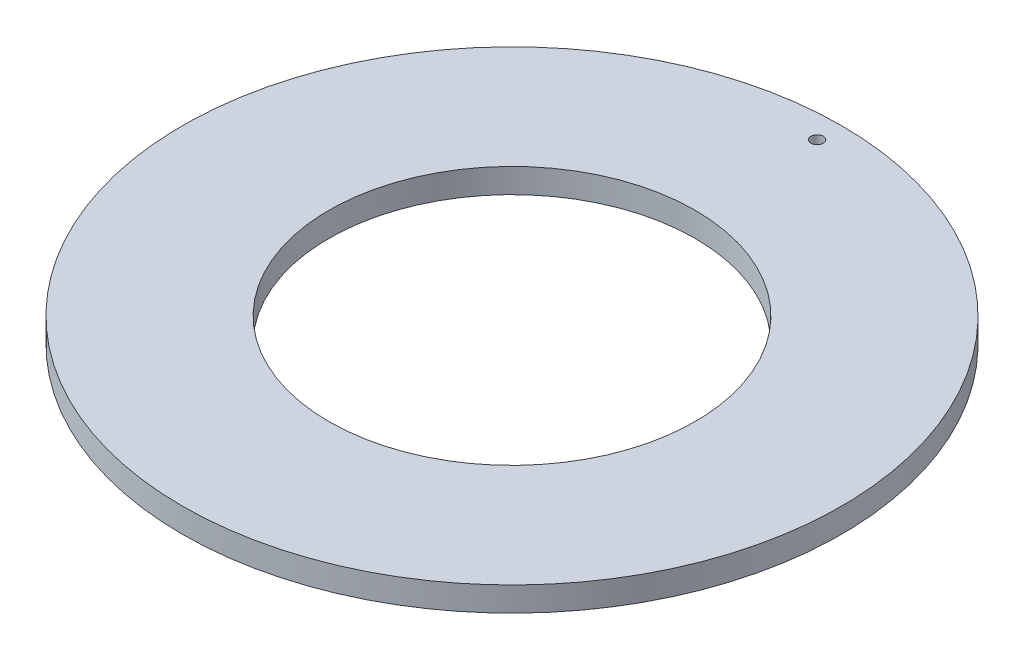
from build123d import *

# Parameters (mm, degrees)
SKETCH1_R               = 13.5
BOSS_EXTRUDE1_DEPTH     = 1
CUT_EXTRUDE3_DEPTH      = 20.118054294
CUT_EXTRUDE3_DEPTH_BACK = 20.118054294
SKETCH4_R               = 0.25
SKETCH4_R_2             = 7.5


with BuildPart() as part:
    # Sketch1 → Boss-Extrude1 (new body)
    with BuildSketch(Plane(origin=(0, 0, 0), x_dir=(1, 0, 0), z_dir=(0, 1, 0))):
        Circle(SKETCH1_R)
    extrude(amount=BOSS_EXTRUDE1_DEPTH)

    # Sketch4 → Cut-Extrude3 (cut, two sides: drawn at the far end of the back side and taken through both)
    with BuildSketch(Plane(origin=(0, 1, 0), x_dir=(1, 0, 0), z_dir=(0, 1, 0)).offset(-CUT_EXTRUDE3_DEPTH_BACK)):
        with Locations((0, 12.5)):
            Circle(SKETCH4_R)
        Circle(SKETCH4_R_2)
    extrude(amount=CUT_EXTRUDE3_DEPTH + CUT_EXTRUDE3_DEPTH_BACK, mode=Mode.SUBTRACT)


solid = part.part
